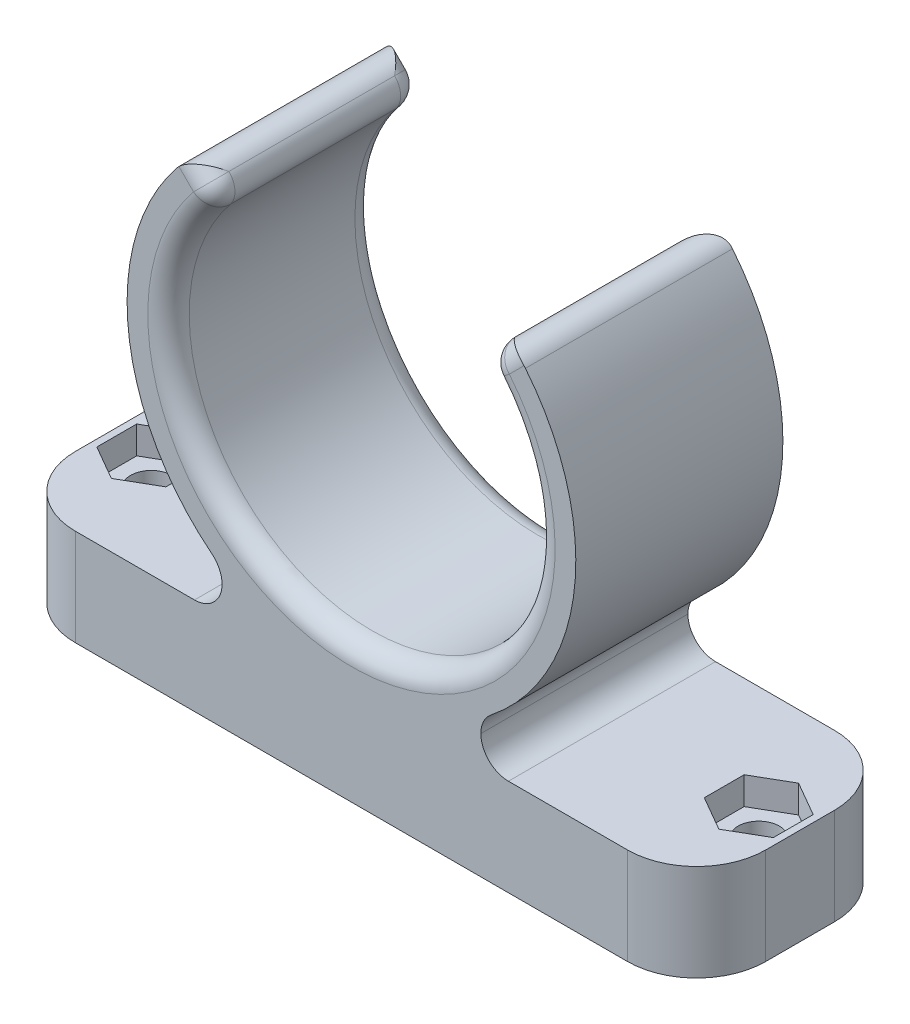
from build123d import *

# Parameters (mm, degrees)
RESSALTO_EXTRUS_O1_DEPTH = 15
ESBO_O3_R                = 1.5
CORTE_EXTRUS_O1_DEPTH    = 7
CORTE_EXTRUS_O2_DEPTH    = 2
FILETE1_R                = 1.5
FILETE2_R                = 2
FILETE3_R                = 5


# Some blends are built 0.0001 mm under size
with BuildPart() as part:
    # Esboço2 → Ressalto-extrusão1 (new body)
    with BuildSketch(Plane.XY):
        with BuildLine():
            Line((-25, -3), (-25, -10))
            Line((-25, -10), (25, -10))
            Line((25, -10), (25, -3))
            Line((25, -3), (9.369164851, -3))
            Line((9.369164851, -3), (9.369164851, -0.027094938))
            ThreePointArc((9.369164851, -0.027094938), (16.19072285, 11.863279554), (11.490485194, 24.740485194))
            Line((11.490485194, 24.740485194), (9.369164851, 22.619164851))
            ThreePointArc((9.369164851, 22.619164851), (0, 0), (-9.369164851, 22.619164851))
            Line((-9.369164851, 22.619164851), (-11.490485194, 24.740485194))
            ThreePointArc((-11.490485194, 24.740485194), (-16.19072285, 11.863279554), (-9.369164851, -0.027094938))
            Line((-9.369164851, -0.027094938), (-9.369164851, -3))
            Line((-9.369164851, -3), (-25, -3))
        make_face()
    extrude(amount=RESSALTO_EXTRUS_O1_DEPTH)

    # Esboço3 → Corte-extrusão1 (cut)
    with BuildSketch(Plane(origin=(0, -3, 0), x_dir=(1, 0, 0), z_dir=(0, 1, 0))):
        with Locations(Location((22, -7.5, 0), (0, 0, 270))):
            Circle(ESBO_O3_R)
        with Locations(Location((-22, -7.5, 0), (0, 0, 180))):
            Circle(ESBO_O3_R)
    extrude(amount=-CORTE_EXTRUS_O1_DEPTH, mode=Mode.SUBTRACT)

    # Esboço5 → Corte-extrusão2 (cut)
    with BuildSketch(Plane(origin=(0, -3, 0), x_dir=(1, 0, 0), z_dir=(0, 1, 0))):
        Polygon((22, -4.613248654), (19.5, -6.056624327), (19.5, -8.943375673), (22, -10.386751346), (24.5, -8.943375673), (24.5, -6.056624327), align=None)
        Polygon((-24.5, -6.056624327), (-22, -4.613248654), (-19.5, -6.056624327), (-19.5, -8.943375673), (-22, -10.386751346), (-24.5, -8.943375673), align=None)
    extrude(amount=-CORTE_EXTRUS_O2_DEPTH, mode=Mode.SUBTRACT)

    # Filete1
    filete1_edges = [part.edges().sort_by_distance(p)[0] for p in [
        (10.429825023, 23.679825023, 15),
        (-10.429825023, 23.679825023, 0),
        (0, 0, 0),
        (10.429825023, 23.679825023, 0),
        (0, 0, 15),
        (-11.490485194, 24.740485194, 7.5),
        (-9.369164851, 22.619164851, 7.5),
        (9.369164851, 22.619164851, 7.5),
        (11.490485194, 24.740485194, 7.5),
        (-10.429825023, 23.679825023, 15),
    ]]
    fillet(filete1_edges, radius=FILETE1_R - 0.0001)  # a hair under: the kernel refuses the full size

    # Filete2
    # the kernel refuses this fillet: 2 mm, written as the material it adds along each edge
    with BuildSketch(Plane(origin=(9.369164851, -0.027094938, 0), x_dir=(0.7999862174060132, 0.600018376352274, 0), z_dir=(0, 0, 1))) as filete2_piece_1:
        with BuildLine():
            CenterArc((1.000602329, -1.999158651), FILETE2_R, 91.661980606, 51.466805628)
            Line((-0.599370106, -0.799121898), (0, 0))
            ThreePointArc((0, 0), (0.471298198, -0.006835961), (0.942596397, 0))
        make_face()
    extrude(amount=15)
    with BuildSketch(Plane(origin=(9.369164851, -3, 0), x_dir=(0, 1, 0), z_dir=(0, 0, 1)), Plane(origin=(-9.369164851, -3, 0), x_dir=(-1, 0, 0), z_dir=(0, 0, 1))) as filete2_piece_2:
        with BuildLine():
            CenterArc((FILETE2_R, -FILETE2_R), FILETE2_R, 90, 90)
            Line((0, -FILETE2_R), (0, 0))
            Line((0, 0), (FILETE2_R, 0))
        make_face()
    extrude(amount=15)
    with BuildSketch(Plane(origin=(-9.369164851, -0.027094938, 0), x_dir=(-0.799986217406012, 0.6000183763522756, 0), z_dir=(0, 0, 1))) as filete2_piece_3:
        with BuildLine():
            CenterArc((1.000602329, 1.999158651), FILETE2_R, 216.871213766, 51.466805628)
            Line((-0.599370106, 0.799121898), (0, 0))
            ThreePointArc((0, 0), (0.471298198, 0.006835961), (0.942596397, 0))
        make_face()
    extrude(amount=15)

    # Filete3
    filete3_edges = [part.edges().sort_by_distance(p)[0] for p in [
        (25, -6.5, 0),
        (-25, -6.5, 0),
        (-25, -6.5, 15),
        (25, -6.5, 15),
    ]]
    fillet(filete3_edges, radius=FILETE3_R)


solid = part.part
